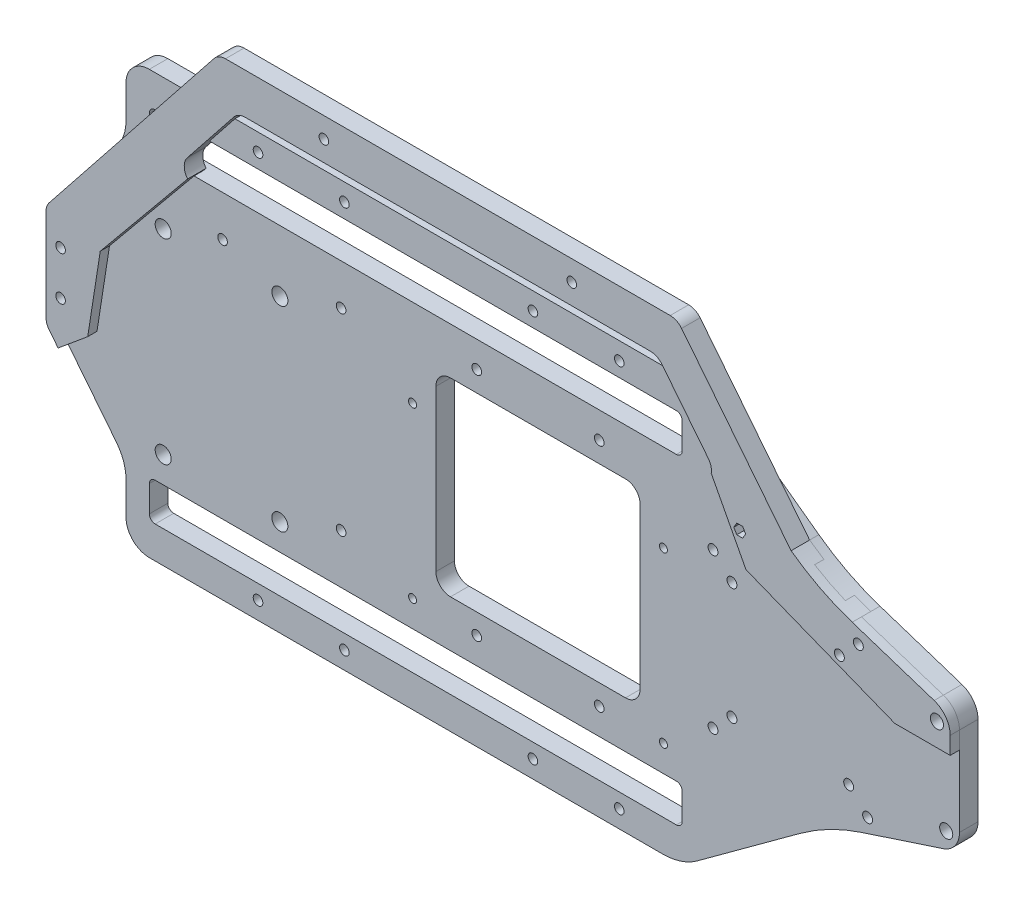
from build123d import *

# Parameters (mm, degrees)
SKETCH2_W                    = 310
SKETCH2_H                    = 145
BASE_DEPTH                   = 3.175
OUTLINE_START                = -3.175
OUTLINE_CUT_DEPTH            = 6.35
M3_MOUNTING_HOLES_DEPTH      = 172.147102298
M3_MOUNTING_HOLES_DEPTH_BACK = 172.147102298
SKETCH20_R                   = 2.25
SKETCH20_R_2                 = 1.65
FILLET2_R                    = 15
FILLET1_R                    = 8
WIRE_SLOTS_DEPTH             = 172.147102298
WIRE_SLOTS_DEPTH_BACK        = 172.147102298
ANTENNA_DEPTH                = 172.147102298
ANTENNA_DEPTH_BACK           = 172.147102298
SKETCH3_R                    = 1.65
M5_VESC_HOLES_D              = 5.5
POWERBOARD_DEPTH             = 172.147102298
POWERBOARD_DEPTH_BACK        = 172.147102298
SKETCH7_R                    = 1.65
M3_CLEARANCE_HOLE1_D         = 3.4
XAVIER_DEPTH                 = 172.147102298
XAVIER_DEPTH_BACK            = 172.147102298
XAVIER_OUTLINE_R             = 1.375
TX2_DEPTH                    = 172.147102298
TX2_DEPTH_BACK               = 172.147102298
SKETCH30_R                   = 1.65
WIRE_SLOT_DEPTH              = 172.147102298
WIRE_SLOT_DEPTH_BACK         = 172.147102298
TOP_MARKER_DEPTH             = 172.147102298
TOP_MARKER_DEPTH_BACK        = 172.147102298
SKETCH31_R                   = 1.65
SKETCH31_R_2                 = 1.7
SKETCH31_R_3                 = 1.375
SKETCH31_R_4                 = 2.75
SKETCH31_R_5                 = 2.25
BOSS_EXTRUDE2_DEPTH          = 6.35
CUT_EXTRUDE1_DEPTH           = 181.287802035


# Read off the part's stored shape, not the designer's step: Outline Cut
with BuildPart() as part:
    # Sketch2 → Base (new, symmetric)
    with BuildSketch(Plane.XY):
        Rectangle(SKETCH2_W, SKETCH2_H)
    extrude(amount=BASE_DEPTH, both=True)

    # Outline Cut outline → Outline Cut (cut)
    with BuildSketch(Plane.XY.offset(OUTLINE_START)):
        with BuildLine():
            Line((155, -72.5), (155, -21))
            Line((155, -21), (121.4, -32))
            ThreePointArc((121.4, -32), (110.500059188, -36.546882309), (100.449037969, -42.748480562))
            Line((100.449037969, -42.748480562), (65.059562446, -68.641072915))
            ThreePointArc((65.059562446, -68.641072915), (59.462026308, -71.510805589), (53.25, -72.5))
            Line((53.25, -72.5), (155, -72.5))
        make_face()
        with BuildLine():
            Line((121.4, 32), (155, 21))
            Line((155, 21), (155, 72.5))
            Line((155, 72.5), (53.25, 72.5))
            ThreePointArc((53.25, 72.5), (59.462026308, 71.510805589), (65.059562446, 68.641072915))
            Line((65.059562446, 68.641072915), (100.449037969, 42.748480562))
            ThreePointArc((100.449037969, 42.748480562), (110.500059188, 36.546882309), (121.4, 32))
        make_face()
        Polygon((-155, -72.5), (-130.75, -72.5), (-130.75, -48), (-155, -17.5), align=None)
        Polygon((-130.75, 48), (-130.75, 72.5), (-155, 72.5), (-155, 17.5), align=None)
    extrude(amount=OUTLINE_CUT_DEPTH, mode=Mode.SUBTRACT)

    # Sketch20 → M3 Mounting Holes (cut, two sides: drawn at the far end of the back side and taken through both)
    with BuildSketch(Plane.XY.offset(-M3_MOUNTING_HOLES_DEPTH_BACK)):
        with Locations((150.445978752, -17.05)):
            Circle(SKETCH20_R)
        with Locations((150.445978752, 17.05)):
            Circle(SKETCH20_R)
        with Locations((38.365720723, -66.5)):
            Circle(SKETCH20_R_2)
        with Locations((8.765720723, -66.5)):
            Circle(SKETCH20_R_2)
        with Locations((-55.884279277, -66.5)):
            Circle(SKETCH20_R_2)
        with Locations((-85.484279277, -66.5)):
            Circle(SKETCH20_R_2)
        with Locations((38.365720723, 66.5)):
            Circle(SKETCH20_R_2)
        with Locations((8.765720723, 66.5)):
            Circle(SKETCH20_R_2)
        with Locations((-55.884279277, 66.5)):
            Circle(SKETCH20_R_2)
        with Locations((-85.484279277, 66.5)):
            Circle(SKETCH20_R_2)
    extrude(amount=M3_MOUNTING_HOLES_DEPTH + M3_MOUNTING_HOLES_DEPTH_BACK, mode=Mode.SUBTRACT)

    # Fillet2
    fillet2_edges = [part.edges().sort_by_distance(p)[0] for p in [
        (-130.75, 48, 0),
        (-130.75, -48, 0),
    ]]
    fillet(fillet2_edges, radius=FILLET2_R)

    # Fillet1
    fillet1_edges = [part.edges().sort_by_distance(p)[0] for p in [
        (155, 21, 0),
        (-130.75, 72.5, 0),
        (-155, 17.5, 0),
        (-155, -17.5, 0),
        (-130.75, -72.5, 0),
        (155, -21, 0),
    ]]
    fillet(fillet1_edges, radius=FILLET1_R)

    # Sketch21 → Wire Slots (cut, two sides: drawn at the far end of the back side and taken through both)
    with BuildSketch(Plane.XY.offset(-WIRE_SLOTS_DEPTH_BACK)):
        with BuildLine():
            Line((57.93900744, 48.499999887), (-120.750000088, 48.499999887))
            ThreePointArc((-120.750000088, 48.499999887), (-122.164213651, 49.085786325), (-122.750000088, 50.499999887))
            Line((-122.750000088, 50.499999887), (-122.750000088, 59.499999887))
            ThreePointArc((-122.750000088, 59.499999887), (-122.164213651, 60.91421345), (-120.750000088, 61.499999887))
            Line((-120.750000088, 61.499999887), (57.93900744, 61.499999887))
            ThreePointArc((57.93900744, 61.499999887), (59.353221002, 60.91421345), (59.93900744, 59.499999887))
            Line((59.93900744, 59.499999887), (59.93900744, 50.499999887))
            ThreePointArc((59.93900744, 50.499999887), (59.353221002, 49.085786325), (57.93900744, 48.499999887))
        make_face()
        with BuildLine():
            Line((-122.750000088, -50.499999887), (-122.750000088, -59.499999887))
            ThreePointArc((-122.750000088, -59.499999887), (-122.164213651, -60.91421345), (-120.750000088, -61.499999887))
            Line((-120.750000088, -61.499999887), (57.93900744, -61.499999887))
            ThreePointArc((57.93900744, -61.499999887), (59.353221002, -60.91421345), (59.93900744, -59.499999887))
            Line((59.93900744, -59.499999887), (59.93900744, -50.499999887))
            ThreePointArc((59.93900744, -50.499999887), (59.353221002, -49.085786325), (57.93900744, -48.499999887))
            Line((57.93900744, -48.499999887), (-120.750000088, -48.499999887))
            ThreePointArc((-120.750000088, -48.499999887), (-122.164213651, -49.085786325), (-122.750000088, -50.499999887))
        make_face()
    extrude(amount=WIRE_SLOTS_DEPTH + WIRE_SLOTS_DEPTH_BACK, mode=Mode.SUBTRACT)

    # Sketch3 → Antenna (cut, two sides: drawn at the far end of the back side and taken through both)
    with BuildSketch(Plane.XY.offset(-ANTENNA_DEPTH_BACK)):
        with Locations((-150, 7.5)):
            Circle(SKETCH3_R)
        with Locations(Location((-150, -7.5, 0), (0, 0, 180))):
            Circle(SKETCH3_R)
    extrude(amount=ANTENNA_DEPTH + ANTENNA_DEPTH_BACK, mode=Mode.SUBTRACT)

    # M5 Vesc Holes (through all)
    with Locations(Plane.XY.offset(3.175)):
        with Locations((-118, 27.500000113), (-78, 27.500000113), (-78, -39.499999887), (-118, -39.499999887)):
            Hole(M5_VESC_HOLES_D / 2)

    # Sketch7 → Powerboard (cut, two sides: drawn at the far end of the back side and taken through both)
    with BuildSketch(Plane.XY.offset(-POWERBOARD_DEPTH_BACK)):
        with Locations((-97.64, 34.500000113)):
            Circle(SKETCH7_R)
        with Locations((-57, 34.500000113)):
            Circle(SKETCH7_R)
        with Locations((-57, -31.539999887)):
            Circle(SKETCH7_R)
    extrude(amount=POWERBOARD_DEPTH + POWERBOARD_DEPTH_BACK, mode=Mode.SUBTRACT)

    # M3 Clearance Hole1 (through all)
    with Locations(Plane.XY.offset(3.175)):
        with Locations((70.499999911, 26.5), (76.999999911, 20), (70.499999911, -26.5), (76.999999911, -20), (123.499999911, -26.5), (116.999999911, -20), (116.999999911, 20), (123.499999911, 26.5)):
            Hole(M3_CLEARANCE_HOLE1_D / 2)

    # Xavier Outline → Xavier (cut, two sides: drawn at the far end of the back side and taken through both)
    with BuildSketch(Plane.XY.offset(-XAVIER_DEPTH_BACK)):
        with Locations((-32.500000089, 18.500000113)):
            Circle(XAVIER_OUTLINE_R)
        with Locations((53.499999911, 18.500000113)):
            Circle(XAVIER_OUTLINE_R)
        with Locations((53.499999911, -39.499999887)):
            Circle(XAVIER_OUTLINE_R)
        with Locations((-32.500000089, -39.499999887)):
            Circle(XAVIER_OUTLINE_R)
    extrude(amount=XAVIER_DEPTH + XAVIER_DEPTH_BACK, mode=Mode.SUBTRACT)

    # Sketch30 → TX2 (cut, two sides: drawn at the far end of the back side and taken through both)
    with BuildSketch(Plane.XY.offset(-TX2_DEPTH_BACK)):
        with Locations((-10.500000089, 39.5)):
            Circle(SKETCH30_R)
        with Locations((31.499999911, 39.5)):
            Circle(SKETCH30_R)
        with Locations((31.499999911, -39.5)):
            Circle(SKETCH30_R)
        with Locations((-10.500000089, -39.5)):
            Circle(SKETCH30_R)
    extrude(amount=TX2_DEPTH + TX2_DEPTH_BACK, mode=Mode.SUBTRACT)

    # Sketch29 → Wire slot (cut, two sides: drawn at the far end of the back side and taken through both)
    with BuildSketch(Plane.XY.offset(-WIRE_SLOT_DEPTH_BACK)):
        with BuildLine():
            Line((40.499999911, 32.499999887), (-19.500000089, 32.499999887))
            ThreePointArc((-19.500000089, 32.499999887), (-23.035533995, 31.035533793), (-24.500000089, 27.499999887))
            Line((-24.500000089, 27.499999887), (-24.500000089, -27.499999887))
            ThreePointArc((-24.500000089, -27.499999887), (-23.035533995, -31.035533793), (-19.500000089, -32.499999887))
            Line((-19.500000089, -32.499999887), (40.499999911, -32.499999887))
            ThreePointArc((40.499999911, -32.499999887), (44.035533817, -31.035533793), (45.499999911, -27.499999887))
            Line((45.499999911, -27.499999887), (45.499999911, 27.499999887))
            ThreePointArc((45.499999911, 27.499999887), (44.035533817, 31.035533793), (40.499999911, 32.499999887))
        make_face()
    extrude(amount=WIRE_SLOT_DEPTH + WIRE_SLOT_DEPTH_BACK, mode=Mode.SUBTRACT)

    # Sketch28 → Top Marker (cut, two sides: drawn at the far end of the back side and taken through both)
    with BuildSketch(Plane.XY.offset(-TOP_MARKER_DEPTH_BACK)):
        Polygon((80.815984942, 39.911182953), (81.826347913, 38.161182953), (83.847073855, 38.161182953), (84.857436826, 39.911182953), (83.847073855, 41.661182953), (81.826347913, 41.661182953), align=None)
    extrude(amount=TOP_MARKER_DEPTH + TOP_MARKER_DEPTH_BACK, mode=Mode.SUBTRACT)


with BuildPart() as body_2:
    # Sketch31 → Boss-Extrude2 (new body)
    with BuildSketch(Plane.XY):
        with BuildLine():
            Line((155, 15.201244436), (155, -15.201244436))
            ThreePointArc((155, -15.201244436), (153.477362332, -19.896324544), (149.489055695, -22.804178195))
            Line((149.489055695, -22.804178195), (121.4, -32))
            ThreePointArc((121.4, -32), (110.500059188, -36.546882309), (100.449037969, -42.748480562))
            Line((100.449037969, -42.748480562), (62.902214424, -89.972320485))
            ThreePointArc((62.902214424, -89.972320485), (61.161213359, -91.363851487), (58.988498855, -91.860595811))
            Line((58.988498855, -91.860595811), (-93.464849292, -91.860595811))
            ThreePointArc((-93.464849292, -91.860595811), (-95.637563796, -91.363851487), (-97.378564861, -89.972320485))
            Line((-97.378564861, -89.972320485), (-153.913715569, -18.866254645))
            ThreePointArc((-153.913715569, -18.866254645), (-154.720623785, -17.402471438), (-155, -15.754529971))
            Line((-155, -15.754529971), (-155, 15.754529971))
            ThreePointArc((-155, 15.754529971), (-154.720623785, 17.402471438), (-153.913715569, 18.866254645))
            Line((-153.913715569, 18.866254645), (-97.378564861, 89.972320485))
            ThreePointArc((-97.378564861, 89.972320485), (-95.637563796, 91.363851487), (-93.464849292, 91.860595811))
            Line((-93.464849292, 91.860595811), (58.988498855, 91.860595811))
            ThreePointArc((58.988498855, 91.860595811), (61.161213359, 91.363851487), (62.902214424, 89.972320485))
            Line((62.902214424, 89.972320485), (100.449037969, 42.748480562))
            ThreePointArc((100.449037969, 42.748480562), (110.500059188, 36.546882309), (121.4, 32))
            Line((121.4, 32), (149.489055695, 22.804178195))
            ThreePointArc((149.489055695, 22.804178195), (153.477362332, 19.896324544), (155, 15.201244436))
        make_face()
        with Locations((-59.738175218, 84.860595811)):
            Circle(SKETCH31_R, mode=Mode.SUBTRACT)
        with Locations((25.261824782, 84.860595811)):
            Circle(SKETCH31_R, mode=Mode.SUBTRACT)
        with Locations((-10.500000089, 39.5)):
            Circle(SKETCH31_R, mode=Mode.SUBTRACT)
        with Locations((31.499999911, 39.5)):
            Circle(SKETCH31_R, mode=Mode.SUBTRACT)
        with Locations((76.999999911, 20)):
            Circle(SKETCH31_R_2, mode=Mode.SUBTRACT)
        with Locations((70.499999911, 26.5)):
            Circle(SKETCH31_R_2, mode=Mode.SUBTRACT)
        with Locations((53.499999911, 18.500000113)):
            Circle(SKETCH31_R_3, mode=Mode.SUBTRACT)
        with Locations((76.999999911, -20)):
            Circle(SKETCH31_R_2, mode=Mode.SUBTRACT)
        with Locations((70.499999911, -26.5)):
            Circle(SKETCH31_R_2, mode=Mode.SUBTRACT)
        with Locations((53.499999911, -39.499999887)):
            Circle(SKETCH31_R_3, mode=Mode.SUBTRACT)
        with Locations((31.499999911, -39.5)):
            Circle(SKETCH31_R, mode=Mode.SUBTRACT)
        with Locations((-10.500000089, -39.5)):
            Circle(SKETCH31_R, mode=Mode.SUBTRACT)
        with Locations((-32.500000089, -39.499999887)):
            Circle(SKETCH31_R_3, mode=Mode.SUBTRACT)
        with Locations((-57, -31.539999887)):
            Circle(SKETCH31_R, mode=Mode.SUBTRACT)
        with Locations((-78, -39.499999887)):
            Circle(SKETCH31_R_4, mode=Mode.SUBTRACT)
        with Locations((-118, -39.499999887)):
            Circle(SKETCH31_R_4, mode=Mode.SUBTRACT)
        with Locations((-150, -7.5)):
            Circle(SKETCH31_R, mode=Mode.SUBTRACT)
        with Locations((-150, 7.5)):
            Circle(SKETCH31_R, mode=Mode.SUBTRACT)
        with Locations((-32.500000089, 18.500000113)):
            Circle(SKETCH31_R_3, mode=Mode.SUBTRACT)
        with Locations((-57, 34.500000113)):
            Circle(SKETCH31_R, mode=Mode.SUBTRACT)
        with Locations((-97.64, 34.500000113)):
            Circle(SKETCH31_R, mode=Mode.SUBTRACT)
        with Locations((-78, 27.500000113)):
            Circle(SKETCH31_R_4, mode=Mode.SUBTRACT)
        with Locations((-118, 27.500000113)):
            Circle(SKETCH31_R_4, mode=Mode.SUBTRACT)
        with Locations((123.499999911, -26.5)):
            Circle(SKETCH31_R_2, mode=Mode.SUBTRACT)
        with Locations((150.445978752, -17.05)):
            Circle(SKETCH31_R_5, mode=Mode.SUBTRACT)
        with Locations((150.445978752, 17.05)):
            Circle(SKETCH31_R_5, mode=Mode.SUBTRACT)
        with Locations((123.499999911, 26.5)):
            Circle(SKETCH31_R_2, mode=Mode.SUBTRACT)
        with Locations((116.999999911, 20)):
            Circle(SKETCH31_R_2, mode=Mode.SUBTRACT)
        with Locations((116.999999911, -20)):
            Circle(SKETCH31_R_2, mode=Mode.SUBTRACT)
        with Locations(Location((25.261824782, -84.860595811, 0), (0, 0, 180))):
            Circle(SKETCH31_R, mode=Mode.SUBTRACT)
        with Locations(Location((-59.738175218, -84.860595811, 0), (0, 0, 180))):
            Circle(SKETCH31_R, mode=Mode.SUBTRACT)
        with BuildLine():
            Line((-86.710179949, 77.860595811), (52.233829513, 77.860595811))
            ThreePointArc((52.233829513, 77.860595811), (54.406544017, 77.363851487), (56.147545082, 75.972320485))
            Line((56.147545082, 75.972320485), (72.049184426, 55.972320485))
            ThreePointArc((72.049184426, 55.972320485), (72.638724533, 50.687881307), (68.135468857, 47.860595811))
            Line((68.135468857, 47.860595811), (-102.611819294, 47.860595811))
            ThreePointArc((-102.611819294, 47.860595811), (-107.11507497, 50.687881307), (-106.525534863, 55.972320485))
            Line((-106.525534863, 55.972320485), (-90.623895518, 75.972320485))
            ThreePointArc((-90.623895518, 75.972320485), (-88.882894453, 77.363851487), (-86.710179949, 77.860595811))
        make_face(mode=Mode.SUBTRACT)
        with BuildLine():
            Line((45.499999911, -27.499999887), (45.499999911, 27.499999887))
            ThreePointArc((45.499999911, 27.499999887), (44.035533817, 31.035533793), (40.499999911, 32.499999887))
            Line((40.499999911, 32.499999887), (-19.500000089, 32.499999887))
            ThreePointArc((-19.500000089, 32.499999887), (-23.035533995, 31.035533793), (-24.500000089, 27.499999887))
            Line((-24.500000089, 27.499999887), (-24.500000089, -27.499999887))
            ThreePointArc((-24.500000089, -27.499999887), (-23.035533995, -31.035533793), (-19.500000089, -32.499999887))
            Line((-19.500000089, -32.499999887), (40.499999911, -32.499999887))
            ThreePointArc((40.499999911, -32.499999887), (44.035533817, -31.035533793), (45.499999911, -27.499999887))
        make_face(mode=Mode.SUBTRACT)
        Polygon((83.847073855, 38.161182953), (84.857436826, 39.911182953), (83.847073855, 41.661182953), (81.826347913, 41.661182953), (80.815984942, 39.911182953), (81.826347913, 38.161182953), align=None, mode=Mode.SUBTRACT)
        with BuildLine():
            Line((-86.710179949, -77.860595811), (52.233829513, -77.860595811))
            ThreePointArc((52.233829513, -77.860595811), (54.406544017, -77.363851487), (56.147545082, -75.972320485))
            Line((56.147545082, -75.972320485), (72.049184426, -55.972320485))
            ThreePointArc((72.049184426, -55.972320485), (72.638724533, -50.687881307), (68.135468857, -47.860595811))
            Line((68.135468857, -47.860595811), (-102.611819294, -47.860595811))
            ThreePointArc((-102.611819294, -47.860595811), (-107.11507497, -50.687881307), (-106.525534863, -55.972320485))
            Line((-106.525534863, -55.972320485), (-90.623895518, -75.972320485))
            ThreePointArc((-90.623895518, -75.972320485), (-88.882894453, -77.363851487), (-86.710179949, -77.860595811))
        make_face(mode=Mode.SUBTRACT)
    extrude(amount=BOSS_EXTRUDE2_DEPTH)

    # Sketch32 → Cut-Extrude1 (cut, through all)
    with BuildSketch(Plane(origin=(0, 0, 0), x_dir=(-1, 0, 0), z_dir=(0, 0, -1))):
        Polygon((-160.446354652, 9.248580402), (-136.003677875, 9.248580402), (-84.971332443, 29.397273421), (-72.638724533, 52.860595811), (-59.428178298, 68.087635161), (91.304310167, 68.087635161), (136.399583058, 13.258267839), (140.691663916, -14.268294113), (167.217636732, -36.333708722), (115.029218749, -105.367755294), (-78.805028488, -120.231545226), (-142.136844303, -65.286663179), (-176.301063913, 9.248580402), align=None)
    extrude(amount=-CUT_EXTRUDE1_DEPTH, mode=Mode.SUBTRACT)


solid = Compound([part.part, body_2.part])
